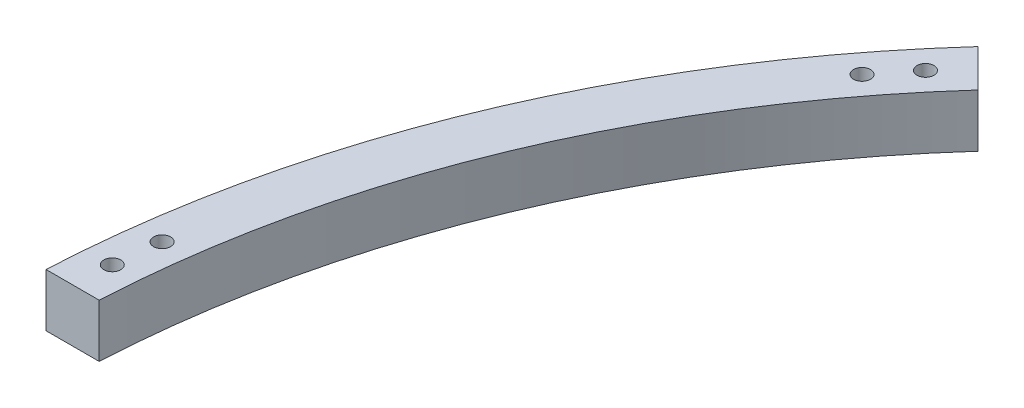
from build123d import *

# Parameters (mm, degrees)
BASE_DEPTH                 = 5
F_3_2_3_2_DIAMETER_HOLE1_D = 3.2


with BuildPart() as part:
    # Sketch1 → base (new, symmetric)
    with BuildSketch(Plane(origin=(0, 0, 0), x_dir=(1, 0, 0), z_dir=(0, 1, 0))):
        with BuildLine():
            Line((-141.235146462, 127.093010838), (-148.31553673, 134.173401106))
            ThreePointArc((-148.31553673, 134.173401106), (-184.775906502, 76.536686473), (-199.749843554, 10))
            Line((-199.749843554, 10), (-189.73665961, 10))
            ThreePointArc((-189.73665961, 10), (-175.537111177, 72.709852149), (-141.235146462, 127.093010838))
        make_face()
    extrude(amount=BASE_DEPTH, both=True)

    # Ø3.2 (3.2) Diameter Hole1 (through all)
    with Locations(Plane(origin=(0, 5, 0), x_dir=(1, 0, 0), z_dir=(0, 1, 0))):
        with Locations((-194.257966128, 16.995369836), (-149.378666408, 125.343583889), (-154.703901357, 118.708478657), (-193.331747968, 25.452607483)):
            Hole(F_3_2_3_2_DIAMETER_HOLE1_D / 2)


solid = part.part
